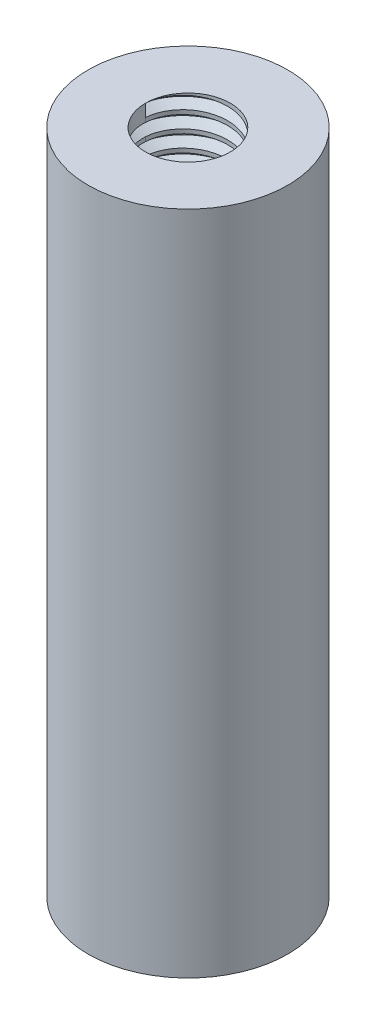
from build123d import *

# Parameters (mm, degrees)
SKETCH1_R           = 4.7625
SKETCH1_R_2         = 2.0193
BOSS_EXTRUDE1_DEPTH = 15.875
THREAD1_PITCH       = 0.79375


with BuildPart() as part:
    # Sketch1 → Boss-Extrude1 (new, symmetric)
    with BuildSketch(Plane(origin=(0, 0, 0), x_dir=(1, 0, 0), z_dir=(0, 1, 0))):
        with Locations(Location((0, 0, 0), (0, 0, 270))):
            Circle(SKETCH1_R)
        with Locations(Location((0, 0, 0), (0, 0, 270))):
            Circle(SKETCH1_R_2, mode=Mode.SUBTRACT)
    extrude(amount=BOSS_EXTRUDE1_DEPTH, both=True)

    # Thread1: the profile of Thread Profile2 profile screwed along a right-hand helix of 12 turns, 8 arcs to a turn; built about Z, then put on its axis
    thread1_z = Axis((0, 0, 0), (0, 0, 1))
    thread1_corners = [(2.019, 0, -0.000173205), (2.448929788, 0, 0.248046874), (2.448929788, 0, 0.347265624), (2.019, 0, 0.595485703)]
    with BuildLine(mode=Mode.PRIVATE) as thread1_profile:
        Line(thread1_corners[0], thread1_corners[1])
        Line(thread1_corners[1], thread1_corners[2])
        Line(thread1_corners[2], thread1_corners[3])
        Line(thread1_corners[3], thread1_corners[0])
    thread1_cap = Face(thread1_profile.wire())
    thread1_turn_angles = [0, 22.5, 45, 67.5, 90, 112.5, 135, 157.5, 180, 202.5, 225, 247.5, 270, 292.5, 315, 337.5, 360]
    thread1_turn_weights = [1, 0.9238795325112867, 1, 0.9238795325112867, 1, 0.9238795325112867, 1, 0.9238795325112867, 1, 0.9238795325112867, 1, 0.9238795325112867, 1, 0.9238795325112867, 1, 0.9238795325112867, 1]
    thread1_turn_rails = [Edge.make_bspline([Vector(p[0], p[1], 0).rotate(thread1_z, thread1_turn_angles[k]) / thread1_turn_weights[k] + Vector(0, 0, p[2] + THREAD1_PITCH * thread1_turn_angles[k] / 360) for k in range(17)], [0, 0, 0, 1, 1, 2, 2, 3, 3, 4, 4, 5, 5, 6, 6, 7, 7, 8, 8, 8], 2, thread1_turn_weights) for p in thread1_corners]
    thread1_turn_sides = [Face.make_surface_from_curves(thread1_turn_rails[p[0]], thread1_turn_rails[p[1]]) for p in [(0, 1), (1, 2), (2, 3), (3, 0)]]
    thread1 = Plane(origin=(0, 15.875, 0), x_dir=(-1, 0, 0), z_dir=(0, -1, 0)) * Solid(Shell([*[p.moved(Location((0, 0, THREAD1_PITCH * i))) for i in range(12) for p in thread1_turn_sides], thread1_cap, thread1_cap.rotate(thread1_z, 4320).moved(Location((0, 0, THREAD1_PITCH * 4320 / 360)))]))
    add(thread1, mode=Mode.SUBTRACT)

    # Mirror3: Thread1 across plane
    add(thread1.mirror(Plane.ZX), mode=Mode.SUBTRACT)


solid = part.part
